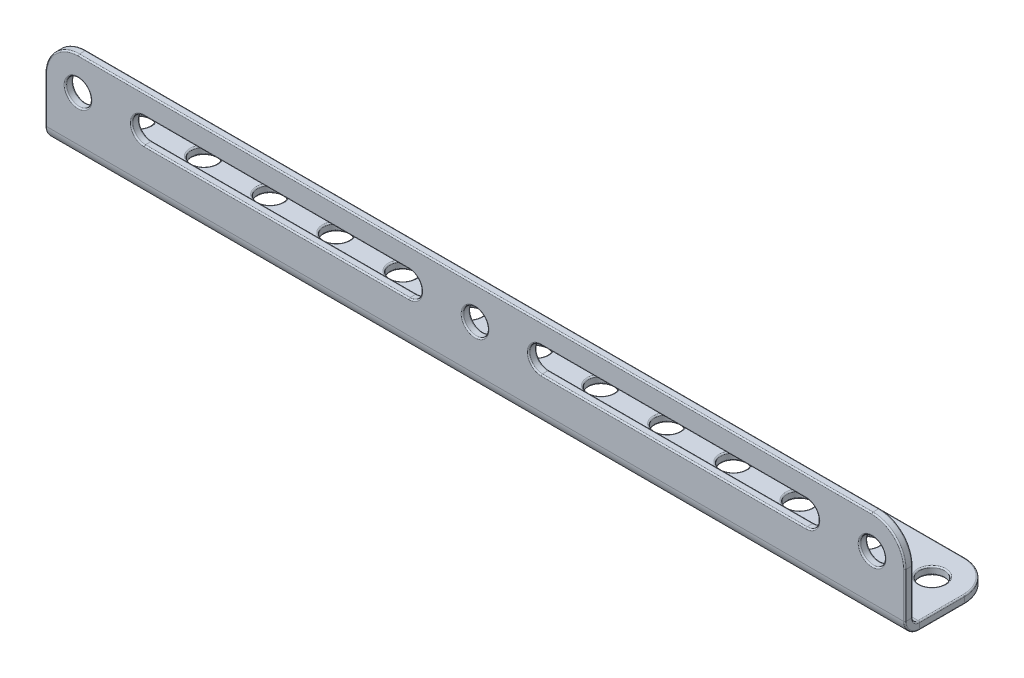
from build123d import *

# Parameters (mm, degrees)
SKETCH1_R                  = 2.413
BASE_FLANGE1_DEPTH         = 1.524
SKETCHED_START             = -18.06705556
SKETCHED_BEND1_DEPTH       = 18.06705556
SKETCHED_START_2           = -19.304
SKETCHED_BEND1_2_OUTLINE_R = 2.413
SKETCHED_BEND1_2_DEPTH     = 0.13465556
SKETCHED_START_3           = -20.574
SKETCHED_BEND1_3_OUTLINE_R = 2.413
SKETCHED_BEND1_3_DEPTH     = 2.794
SKETCHED_BEND1_4_DEPTH     = 164.973
SKETCH4_R                  = 2.413
CUT_EXTRUDE1_DEPTH         = 170.543097368
LPATTERN1_COUNT            = 13
LPATTERN1_PITCH            = 12.7
FILLET1_R                  = 0.254


with BuildPart() as part:
    # Base-Flange1: sheet metal written as solids
    # Sketch1 → Base-Flange1 (new body)
    with BuildSketch(Plane(origin=(0, 0, 0), x_dir=(1, 0, 0), z_dir=(0, 1, 0))):
        with BuildLine():
            Line((6.35, 0), (158.623, 0))
            ThreePointArc((158.623, 0), (163.113128061, 1.859871939), (164.973, 6.35))
            Line((164.973, 6.35), (164.973, 29.21))
            ThreePointArc((164.973, 29.21), (163.113128061, 33.700128061), (158.623, 35.56))
            Line((158.623, 35.56), (6.35, 35.56))
            ThreePointArc((6.35, 35.56), (1.859871939, 33.700128061), (0, 29.21))
            Line((0, 29.21), (0, 6.35))
            ThreePointArc((0, 6.35), (1.859871939, 1.859871939), (6.35, 0))
        make_face()
        with Locations(Location((6.2865, 6.35, 0), (0, 0, 90))):
            Circle(SKETCH1_R, mode=Mode.SUBTRACT)
        with Locations(Location((82.4865, 6.35, 0), (0, 0, 90))):
            Circle(SKETCH1_R, mode=Mode.SUBTRACT)
        with Locations(Location((158.6865, 6.35, 0), (0, 0, 90))):
            Circle(SKETCH1_R, mode=Mode.SUBTRACT)
        with BuildLine():
            Line((18.9865, 8.763), (69.7865, 8.763))
            ThreePointArc((69.7865, 8.763), (72.1995, 6.35), (69.7865, 3.937))
            Line((69.7865, 3.937), (18.9865, 3.937))
            ThreePointArc((18.9865, 3.937), (16.5735, 6.35), (18.9865, 8.763))
        make_face(mode=Mode.SUBTRACT)
        with BuildLine():
            Line((95.1865, 8.763), (145.9865, 8.763))
            ThreePointArc((145.9865, 8.763), (148.3995, 6.35), (145.9865, 3.937))
            Line((145.9865, 3.937), (95.1865, 3.937))
            ThreePointArc((95.1865, 3.937), (92.7735, 6.35), (95.1865, 8.763))
        make_face(mode=Mode.SUBTRACT)
    extrude(amount=BASE_FLANGE1_DEPTH)

    # Sketched Bend1: read off the stored shape, not the designer's step
    # Sketched Bend1 outline → Sketched Bend1 (cut)
    with BuildSketch(Plane.XY.offset(SKETCHED_START)):
        Polygon((164.973, 1.524), (0, 1.524), (0, 1.4e-08), (164.973, 0), align=None)
    extrude(amount=SKETCHED_BEND1_DEPTH, mode=Mode.SUBTRACT)

    # Sketched Bend1 2 outline → Sketched Bend1 2 (add)
    with BuildSketch(Plane.XY.offset(SKETCHED_START_2)):
        with BuildLine():
            Line((158.623, 17.78), (6.35, 17.78))
            ThreePointArc((6.35, 17.78), (1.859871939, 15.920128061), (0, 11.43))
            Line((0, 11.43), (0, 1.524))
            Line((0, 1.524), (164.973, 1.524))
            Line((164.973, 1.524), (164.973, 11.43))
            ThreePointArc((164.973, 11.43), (163.113128061, 15.920128061), (158.623, 17.78))
        make_face()
        with Locations((6.2865, 11.43)):
            Circle(SKETCHED_BEND1_2_OUTLINE_R, mode=Mode.SUBTRACT)
        with BuildLine():
            ThreePointArc((18.9865, 9.017), (16.5735, 11.43), (18.9865, 13.843))
            Line((18.9865, 13.843), (69.7865, 13.843))
            ThreePointArc((69.7865, 13.843), (72.1995, 11.43), (69.7865, 9.017))
            Line((69.7865, 9.017), (18.9865, 9.017))
        make_face(mode=Mode.SUBTRACT)
        with Locations((82.4865, 11.43)):
            Circle(SKETCHED_BEND1_2_OUTLINE_R, mode=Mode.SUBTRACT)
        with BuildLine():
            ThreePointArc((95.1865, 9.017), (92.7735, 11.43), (95.1865, 13.843))
            Line((95.1865, 13.843), (145.9865, 13.843))
            ThreePointArc((145.9865, 13.843), (148.3995, 11.43), (145.9865, 9.017))
            Line((145.9865, 9.017), (95.1865, 9.017))
        make_face(mode=Mode.SUBTRACT)
        with Locations((158.6865, 11.43)):
            Circle(SKETCHED_BEND1_2_OUTLINE_R, mode=Mode.SUBTRACT)
    extrude(amount=SKETCHED_BEND1_2_DEPTH)

    # Sketched Bend1 3 outline → Sketched Bend1 3 (add)
    with BuildSketch(Plane.XY.offset(SKETCHED_START_3)):
        with BuildLine():
            Line((158.623, 17.78), (6.35, 17.78))
            ThreePointArc((6.35, 17.78), (1.859871939, 15.920128061), (0, 11.43))
            Line((0, 11.43), (0, 1.524))
            Line((0, 1.524), (164.973, 1.524))
            Line((164.973, 1.524), (164.973, 11.43))
            ThreePointArc((164.973, 11.43), (163.113128061, 15.920128061), (158.623, 17.78))
        make_face()
        with Locations((6.2865, 11.43)):
            Circle(SKETCHED_BEND1_3_OUTLINE_R, mode=Mode.SUBTRACT)
        with BuildLine():
            ThreePointArc((18.9865, 9.017), (16.5735, 11.43), (18.9865, 13.843))
            Line((18.9865, 13.843), (69.7865, 13.843))
            ThreePointArc((69.7865, 13.843), (72.1995, 11.43), (69.7865, 9.017))
            Line((69.7865, 9.017), (18.9865, 9.017))
        make_face(mode=Mode.SUBTRACT)
        with Locations((82.4865, 11.43)):
            Circle(SKETCHED_BEND1_3_OUTLINE_R, mode=Mode.SUBTRACT)
        with BuildLine():
            ThreePointArc((95.1865, 9.017), (92.7735, 11.43), (95.1865, 13.843))
            Line((95.1865, 13.843), (145.9865, 13.843))
            ThreePointArc((145.9865, 13.843), (148.3995, 11.43), (145.9865, 9.017))
            Line((145.9865, 9.017), (95.1865, 9.017))
        make_face(mode=Mode.SUBTRACT)
        with Locations((158.6865, 11.43)):
            Circle(SKETCHED_BEND1_3_OUTLINE_R, mode=Mode.SUBTRACT)
    extrude(amount=SKETCHED_BEND1_3_DEPTH)

    # Sketched Bend1 4 outline → Sketched Bend1 4 (cut)
    with BuildSketch(Plane.YZ):
        with BuildLine():
            Line((17.78, -20.574), (17.78, -19.304))
            Line((17.78, -19.304), (2.794, -19.304000014))
            ThreePointArc((2.794, -19.304000014), (1.895974398, -19.675974398), (1.524000014, -20.574))
            Line((1.524000014, -20.574), (17.78, -20.574))
        make_face()
        with BuildLine():
            ThreePointArc((1.4e-08, -20.574), (0.818343664, -18.598343664), (2.794, -17.780000014))
            Line((2.794, -17.780000014), (1.524, -17.78))
            Line((1.524, -17.78), (1.524, -18.06705556))
            Line((1.524, -18.06705556), (0, -18.06705556))
            Line((0, -18.06705556), (1.4e-08, -20.574))
        make_face()
    extrude(amount=SKETCHED_BEND1_4_DEPTH, mode=Mode.SUBTRACT)

    # Sketch4 → Cut-Extrude1 (cut, through all)
    with BuildSketch(Plane(origin=(0, 1.524, 0), x_dir=(-1, 0, 0), z_dir=(0, 1, 0))):
        with Locations(Location((-6.35, -29.21, 0), (0, 0, 90))):
            Circle(SKETCH4_R)
    cut_extrude1 = extrude(amount=-CUT_EXTRUDE1_DEPTH, mode=Mode.SUBTRACT)

    # LPattern1: Cut-Extrude1 ×13
    with Locations(*[(i * LPATTERN1_PITCH, 0, 0) for i in range(1, LPATTERN1_COUNT)]):
        add(cut_extrude1, mode=Mode.SUBTRACT)

    # Fillet1
    fillet1_edges = [part.edges().sort_by_distance(p)[0] for p in [
        (163.113128061, 15.920128061, -19.304000006),
        (6.35, 0, -31.623),
        (6.35, 1.524, -31.623),
        (19.05, 0, -31.623),
        (19.05, 1.524, -31.623),
        (31.75, 0, -31.623),
        (31.75, 1.524, -31.623),
        (44.45, 0, -31.623),
        (44.45, 1.524, -31.623),
        (164.973, 7.112, -19.30400001),
        (57.15, 0, -31.623),
        (57.15, 1.524, -31.623),
        (69.85, 0, -31.623),
        (69.85, 1.524, -31.623),
        (82.55, 0, -31.623),
        (82.55, 1.524, -31.623),
        (95.25, 0, -31.623),
        (95.25, 1.524, -31.623),
        (107.95, 0, -31.623),
        (107.95, 1.524, -31.623),
        (120.65, 0, -31.623),
        (120.65, 1.524, -31.623),
        (133.35, 0, -31.623),
        (133.35, 1.524, -31.623),
        (146.05, 0, -31.623),
        (146.05, 1.524, -31.623),
        (158.75, 0, -31.623),
        (158.75, 1.524, -31.623),
        (16.5735, 11.43, -17.78),
        (44.3865, 13.843, -17.78),
        (72.1995, 11.43, -17.78),
        (44.3865, 9.017, -17.78),
        (16.5735, 11.43, -19.304000006),
        (44.3865, 13.843, -19.304000004),
        (72.1995, 11.43, -19.304000006),
        (44.3865, 9.017, -19.304000008),
        (92.7735, 11.43, -17.78),
        (120.5865, 13.843, -17.78),
        (148.3995, 11.43, -17.78),
        (120.5865, 9.017, -17.78),
        (92.7735, 11.43, -19.304000006),
        (120.5865, 13.843, -19.304000004),
        (148.3995, 11.43, -19.304000006),
        (120.5865, 9.017, -19.304000008),
        (1.859871939, 15.920128061, -19.304000006),
        (3.8735, 11.43, -17.78),
        (3.8735, 11.43, -19.304000006),
        (80.0735, 11.43, -17.78),
        (80.0735, 11.43, -19.304000006),
        (156.2735, 11.43, -17.78),
        (156.2735, 11.43, -19.304000006),
        (82.4865, 17.78, -19.304),
        (0, 7.112, -17.78),
        (0, 7.112, -19.30400001),
        (164.973, 7.112, -17.78),
        (163.113128061, 15.920128061, -17.78),
        (1.859871939, 0, -33.700128061),
        (82.4865, 0, -35.56),
        (163.113128061, 0, -33.700128061),
        (0, 1.524, -24.892),
        (164.973, 1.524, -24.892),
        (163.113128061, 1.524, -33.700128061),
        (82.4865, 1.524, -35.56),
        (1.859871939, 1.524, -33.700128061),
        (164.973, 0, -24.892),
        (0, 0, -24.892),
        (0, 0.818343664, -18.598343664),
        (164.973, 0.818343664, -18.598343664),
        (164.973, 1.895974398, -19.675974398),
        (0, 1.895974398, -19.675974398),
        (82.4865, 17.78, -17.78),
        (1.859871939, 15.920128061, -17.78),
    ]]
    fillet(fillet1_edges, radius=FILLET1_R)


solid = part.part
